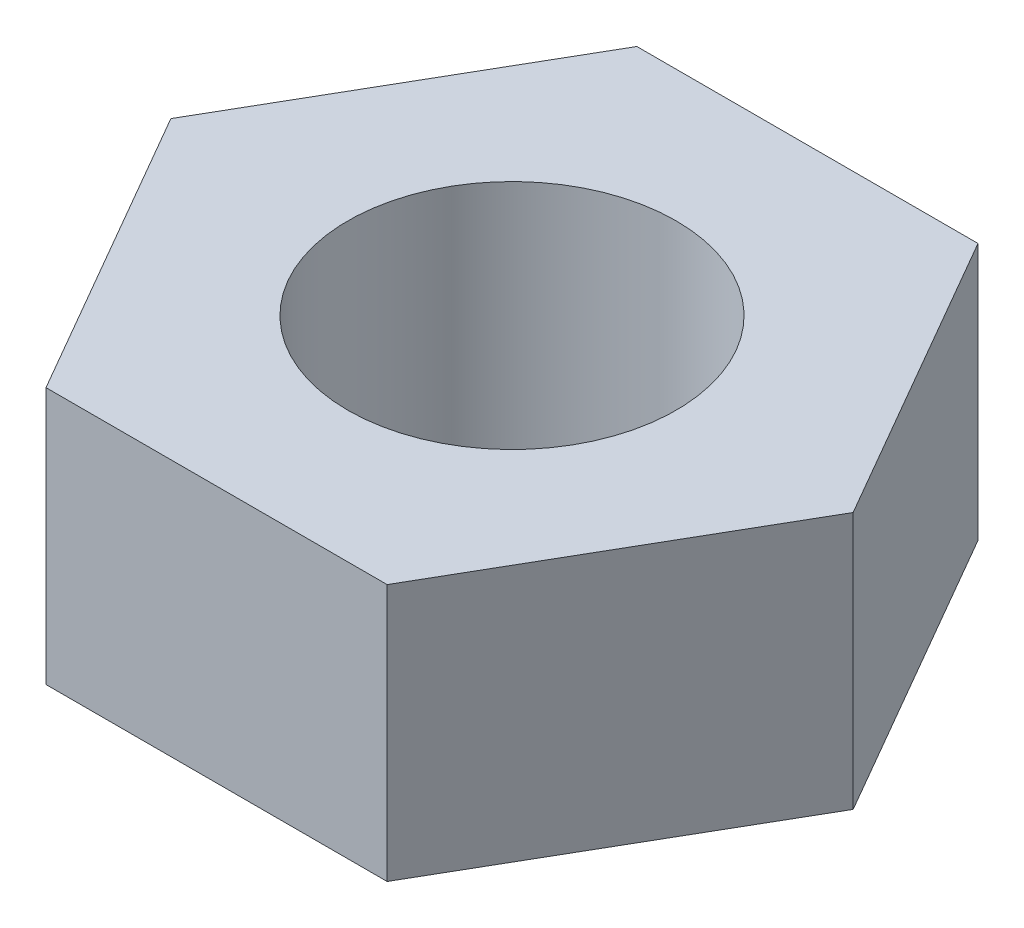
from build123d import *

# Parameters (mm, degrees)
SKETCH1_R           = 1.5
BOSS_EXTRUDE1_DEPTH = 2.35


with BuildPart() as part:
    # Sketch1 → Boss-Extrude1 (new body)
    with BuildSketch(Plane(origin=(0, 0, 0), x_dir=(1, 0, 0), z_dir=(0, 1, 0))):
        Polygon((1.558845727, -2.7), (3.117691454, 0), (1.558845727, 2.7), (-1.558845727, 2.7), (-3.117691454, 0), (-1.558845727, -2.7), align=None)
        Circle(SKETCH1_R, mode=Mode.SUBTRACT)
    extrude(amount=BOSS_EXTRUDE1_DEPTH)


solid = part.part
